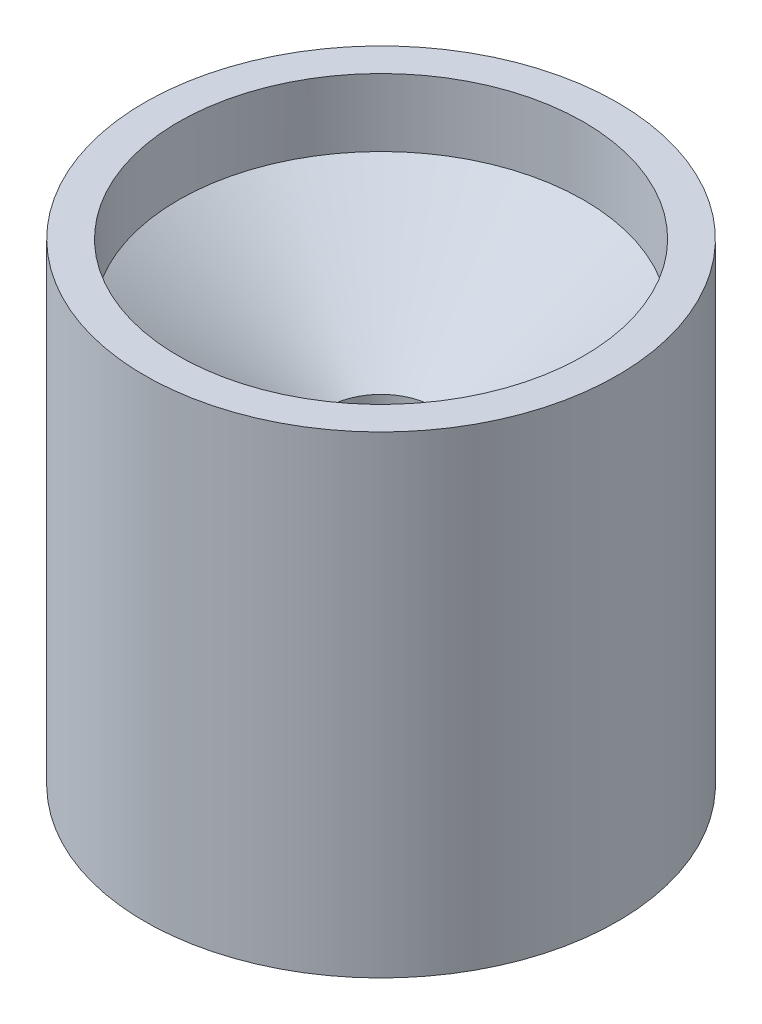
from build123d import *


with BuildPart() as part:
    # Sketch1 → Revolve1 (revolve)
    with BuildSketch(Plane.XY):
        Polygon((-44.45, 0), (-44.45, 76.2), (-44.45, 88.9), (-38.1, 88.9), (-38.1, 76.2), (-10.0076, 56.529489754), (-10.0076, 50.179489754), (-23.453153756, 0), align=None)
    revolve(axis=Axis((0, 0, 0), (0, 1, 0)))


solid = part.part
